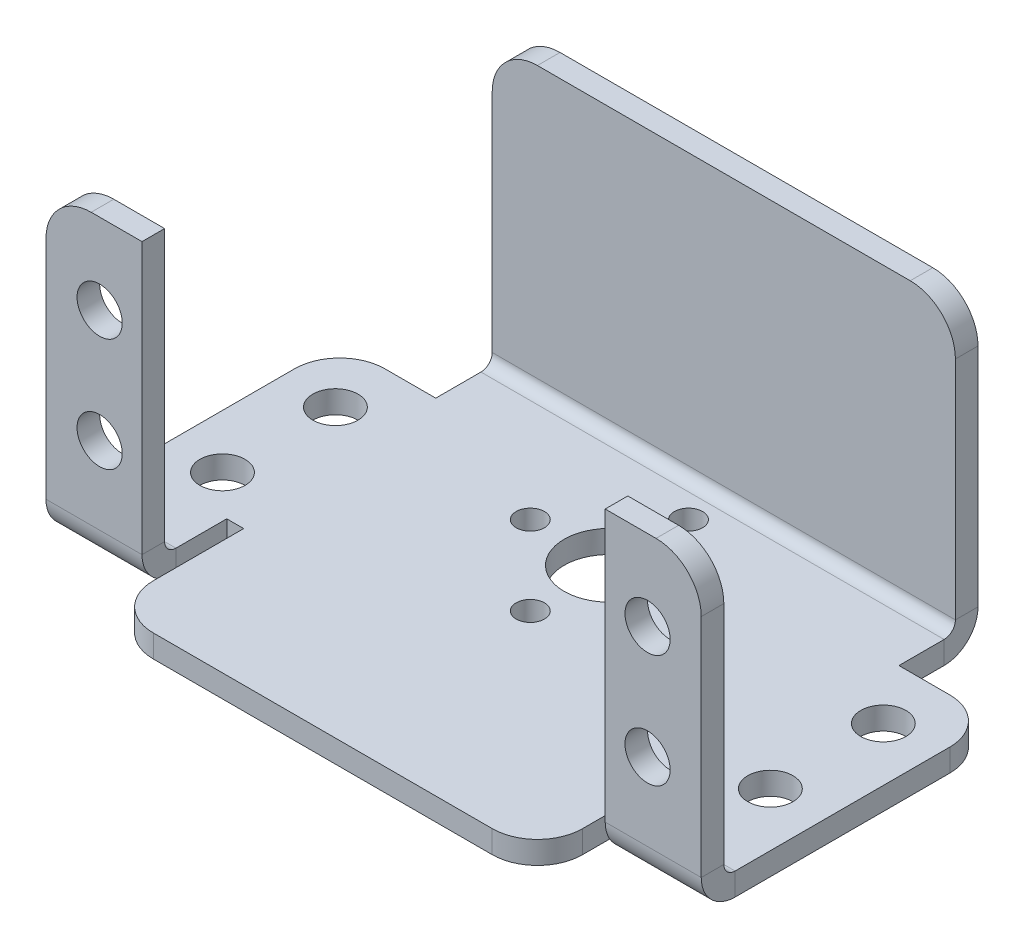
from build123d import *

# Parameters (mm, degrees)
T_LE_DE_BASE_PLI_E1_DEPTH             = 20.5
ESQUISSE8_W                           = 24
ESQUISSE8_H                           = 2
BOSS_EXTRU_1_DEPTH                    = 8.5
T_LE_PLI_E_SUR_AR_TE1_STRIP_W         = 10
T_LE_PLI_E_SUR_AR_TE1_STRIP_H         = 2
T_LE_PLI_E_SUR_AR_TE1_STRIP_CUT_DEPTH = 8.5
T_LE_PLI_E_SUR_AR_TE1_DEPTH           = 8.5
ESQUISSE12_W                          = 1.5
ESQUISSE12_H                          = 12
ENL_V_MAT_EXTRU_1_DEPTH               = 8.5
DIAM_TRE_DU_PER_AGE_4_0_4_1_D         = 4
DIAM_TRE_DU_PER_AGE_4_0_4_2_D         = 4
CONG_1_R                              = 4
DIAM_TRE_DU_PER_AGE_8_0_8_2_D         = 8
DIAM_TRE_DU_PER_AGE_2_5_2_5_3_D       = 2.5
R_P_TITION_CIRCULAIRE2_COUNT          = 4


# Sheet-metal steps are written as plain solids
with BuildPart() as part:
    # Esquisse1 → Tôle de base pliée1 (new body)
    with BuildSketch(Plane(origin=(0, 0, 0), x_dir=(0, 0, -1), z_dir=(1, 0, 0))):
        with BuildLine():
            Line((0, 27), (0, 3))
            ThreePointArc((0, 3), (-0.878679656, 0.878679656), (-3, 0))
            Line((-3, 0), (-37.5, 0))
            Line((-37.5, 0), (-37.5, 2))
            Line((-37.5, 2), (-3, 2))
            ThreePointArc((-3, 2), (-2.292893219, 2.292893219), (-2, 3))
            Line((-2, 3), (-2, 27))
            Line((-2, 27), (0, 27))
        make_face()
    extrude(amount=T_LE_DE_BASE_PLI_E1_DEPTH)

    # Esquisse8 → Boss.-Extru.1 (add)
    with BuildSketch(Plane(origin=(20.5, 0, 0), x_dir=(0, 0, -1), z_dir=(1, 0, 0))):
        with Locations((-19, 1)):
            Rectangle(ESQUISSE8_W, ESQUISSE8_H)
    extrude(amount=BOSS_EXTRU_1_DEPTH)

    # Tôle pliée sur arête1 strip (across the edge) → Tôle pliée sur arête1 strip cut (cut)
    with BuildSketch(Plane(origin=(20.5, 2, 31), x_dir=(0, 0, -1), z_dir=(1, 0, 0))):
        with Locations((-4, -1)):
            Rectangle(T_LE_PLI_E_SUR_AR_TE1_STRIP_W, T_LE_PLI_E_SUR_AR_TE1_STRIP_H)
    extrude(amount=T_LE_PLI_E_SUR_AR_TE1_STRIP_CUT_DEPTH, mode=Mode.SUBTRACT)

    # Tôle pliée sur arête1 section (across the edge) → Tôle pliée sur arête1 (add)
    with BuildSketch(Plane(origin=(20.5, 2, 31), x_dir=(0, 0, -1), z_dir=(1, 0, 0))):
        with BuildLine():
            Line((-2, 1), (-2, 25))
            Line((-2, 25), (0, 25))
            Line((0, 25), (0, 1))
            ThreePointArc((0, 1), (0.292893219, 0.292893219), (1, 0))
            Line((1, 0), (1, -2))
            ThreePointArc((1, -2), (-1.121320344, -1.121320344), (-2, 1))
        make_face()
    extrude(amount=T_LE_PLI_E_SUR_AR_TE1_DEPTH)

    # Esquisse12 → Enlèv. mat.-Extru.1 (cut)
    with BuildSketch(Plane(origin=(0, 2, 0), x_dir=(1, 0, 0), z_dir=(0, 1, 0))):
        with Locations((19.75, -31.5)):
            Rectangle(ESQUISSE12_W, ESQUISSE12_H)
    extrude(amount=-ENL_V_MAT_EXTRU_1_DEPTH, mode=Mode.SUBTRACT)

    # Diamètre du perçage Ø4.0 (4)1 (through all)
    with Locations(Plane(origin=(0, 2, 0), x_dir=(1, 0, 0), z_dir=(0, 1, 0))):
        with Locations((24.25, -12.13), (24.25, -22.13)):
            Hole(DIAM_TRE_DU_PER_AGE_4_0_4_1_D / 2)

    # Diamètre du perçage Ø4.0 (4)2 (through all)
    with Locations(Plane.XY.offset(33)):
        with Locations((24.25, 19.87), (24.25, 9.87)):
            Hole(DIAM_TRE_DU_PER_AGE_4_0_4_2_D / 2)

    # Congé1
    cong_1_edges = [part.edges().sort_by_distance(p)[0] for p in [
        (20.5, 27, 1),
        (29, 1, 7),
        (29, 27, 32),
        (19, 1, 37.5),
    ]]
    fillet(cong_1_edges, radius=CONG_1_R)

    # Symétrie1: part across plane


with BuildPart() as part_1:
    add(part.part)
    add(part.part.mirror(Plane(origin=(0, 3, 3), x_dir=(0, 0, 1), z_dir=(1, 0, 0))))

    # Diamètre du perçage Ø8.0 (8)2 (through all)
    with Locations(Plane(origin=(0, 2, 0), x_dir=(1, 0, 0), z_dir=(0, 1, 0))):
        with Locations((0, -12.13)):
            Hole(DIAM_TRE_DU_PER_AGE_8_0_8_2_D / 2)

    # Diamètre du perçage Ø2.5 (2.5)3 (through all)
    with Locations(Plane(origin=(0, 2, 0), x_dir=(1, 0, 0), z_dir=(0, 1, 0))):
        with Locations((0, -5.13)):
            diam_tre_du_per_age_2_5_2_5_3 = Hole(DIAM_TRE_DU_PER_AGE_2_5_2_5_3_D / 2)

    # Répétition circulaire2: Diamètre du perçage Ø2.5 (2.5)3 ×4 about axis
    r_p_tition_circulaire2_axis = Axis((0, 0, 12.13), (0, 1, 0))
    for i in range(1, R_P_TITION_CIRCULAIRE2_COUNT):
        add(diam_tre_du_per_age_2_5_2_5_3.rotate(r_p_tition_circulaire2_axis, i * 360 / R_P_TITION_CIRCULAIRE2_COUNT), mode=Mode.SUBTRACT)


solid = part_1.part
